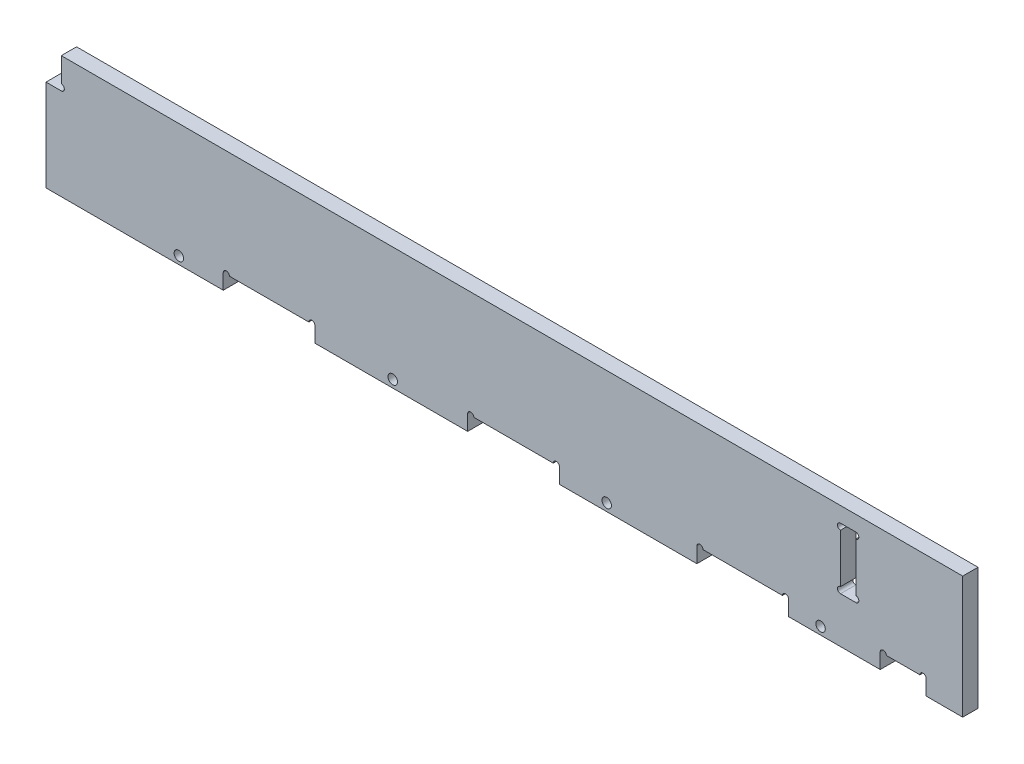
from build123d import *

# Parameters (mm, degrees)
SKETCH_1_W          = 300
SKETCH_1_H          = 40
EXTRUDE_1_DEPTH     = 5
SKETCH_2_W          = 5
SKETCH_2_H          = 10
SKETCH_2_W_2        = 30
SKETCH_2_H_2        = 5
SKETCH_2_W_3        = 15
SKETCH_2_H_3        = 20
CUT_EXTRUDE_1_DEPTH = 5
SKETCH_3_R          = 1
CUT_EXTRUDE_2_DEPTH = 5
SKETCH_4_R          = 1.55
CUT_EXTRUDE_3_DEPTH = 10


with BuildPart() as part:
    # 스케치1 → 보스-돌출1 (new body)
    with BuildSketch(Plane.XY):
        with Locations((150, 20)):
            Rectangle(SKETCH_1_W, SKETCH_1_H)
    extrude(amount=EXTRUDE_1_DEPTH)

    # 스케치2 → 컷-돌출1 (cut)
    with BuildSketch(Plane.XY.offset(5)):
        with Locations((2.5, 35)):
            Rectangle(SKETCH_2_W, SKETCH_2_H)
        with Locations((73, 2.5)):
            Rectangle(SKETCH_2_W_2, SKETCH_2_H_2)
        with Locations((153, 2.5)):
            Rectangle(SKETCH_2_W_2, SKETCH_2_H_2)
        with Locations((228, 2.5)):
            Rectangle(SKETCH_2_W_2, SKETCH_2_H_2)
        with Locations((280.5, 2.5)):
            Rectangle(SKETCH_2_W_3, SKETCH_2_H_2)
        with Locations((262.5, 25)):
            Rectangle(SKETCH_2_W, SKETCH_2_H_3)
    extrude(amount=-CUT_EXTRUDE_1_DEPTH, mode=Mode.SUBTRACT)

    # 스케치3 → 컷-돌출2 (cut)
    with BuildSketch(Plane.XY.offset(5)):
        with Locations((274, 5)):
            Circle(SKETCH_3_R)
        with Locations((287, 5)):
            Circle(SKETCH_3_R)
        with Locations((260, 16)):
            Circle(SKETCH_3_R)
        with Locations((265, 16)):
            Circle(SKETCH_3_R)
        with Locations((265, 34)):
            Circle(SKETCH_3_R)
        with Locations((260, 34)):
            Circle(SKETCH_3_R)
        with Locations((214, 5)):
            Circle(SKETCH_3_R)
        with Locations((242, 5)):
            Circle(SKETCH_3_R)
        with Locations((87, 5)):
            Circle(SKETCH_3_R)
        with Locations((139, 5)):
            Circle(SKETCH_3_R)
        with Locations((167, 5)):
            Circle(SKETCH_3_R)
        with Locations((5, 31)):
            Circle(SKETCH_3_R)
        with Locations((59, 5)):
            Circle(SKETCH_3_R)
    extrude(amount=-CUT_EXTRUDE_2_DEPTH, mode=Mode.SUBTRACT)

    # 스케치4 → 컷-돌출3 (cut)
    with BuildSketch(Plane(origin=(0, 0, 0), x_dir=(-1, 0, 0), z_dir=(0, 0, -1))):
        with Locations((-253.478741621, 2.5)):
            Circle(SKETCH_4_R)
        with Locations((-183.478741621, 2.5)):
            Circle(SKETCH_4_R)
        with Locations((-113.478741621, 2.5)):
            Circle(SKETCH_4_R)
        with Locations((-43.478741621, 2.5)):
            Circle(SKETCH_4_R)
    extrude(amount=-CUT_EXTRUDE_3_DEPTH, mode=Mode.SUBTRACT)


solid = part.part
